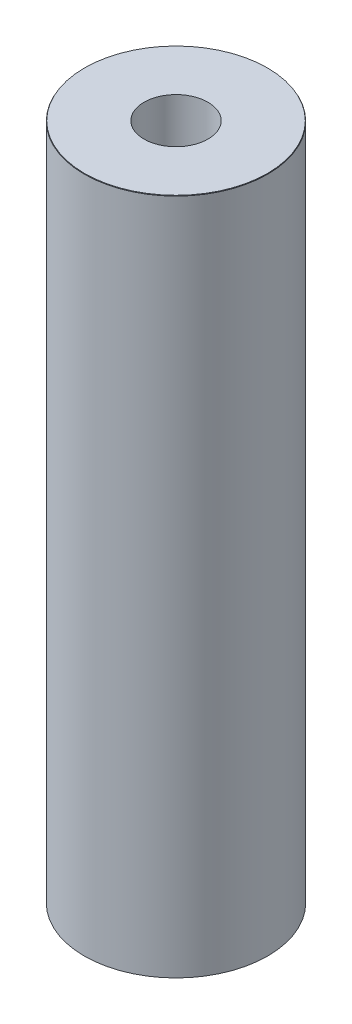
from build123d import *
from OCP.BRepFilletAPI import BRepFilletAPI_MakeChamfer

# Parameters (mm, degrees)
SKETCH1_R           = 47.5
BOSS_EXTRUDE1_DEPTH = 351.051559551
SKETCH2_R           = 16.556482022
CUT_EXTRUDE1_DEPTH  = 358.420896792
CHAMFER1_SIZE       = 0.263666676
CHAMFER1_SIZE2      = 0.148490883


with BuildPart() as part:
    # Sketch1 → Boss-Extrude1 (new body)
    with BuildSketch(Plane(origin=(0, 0, 0), x_dir=(1, 0, 0), z_dir=(0, 1, 0))):
        Circle(SKETCH1_R)
    extrude(amount=BOSS_EXTRUDE1_DEPTH)

    # Sketch2 → Cut-Extrude1 (cut, through all)
    with BuildSketch(Plane(origin=(0, 0, 0), x_dir=(1, 0, 0), z_dir=(0, 1, 0))):
        Circle(SKETCH2_R)
    extrude(amount=CUT_EXTRUDE1_DEPTH, mode=Mode.SUBTRACT)

    # Chamfer1: one chamfer whose edges measure the first distance from different faces: ONE call of the kernel's chamfer builder (chamfer() names one face for all edges)
    chamfer1_edges_1 = [part.edges().sort_by_distance(p)[0] for p in [
        (-47.5, 351.051559551, 0),
    ]]
    chamfer1_side_1 = [part.faces().sort_by_distance(p)[0] for p in [
        (-47.5, 175.525779776, 0),
    ]]
    chamfer1_edges_2 = [part.edges().sort_by_distance(p)[0] for p in [
        (-47.5, 0, 0),
    ]]
    chamfer1_side_2 = [part.faces().sort_by_distance(p)[0] for p in [
        (-46.156497116, 0, 0),
    ]]
    chamfer1 = BRepFilletAPI_MakeChamfer(part.part.solid().wrapped)
    for e in chamfer1_edges_1:
        chamfer1.Add(CHAMFER1_SIZE, CHAMFER1_SIZE2, e.wrapped, chamfer1_side_1[0].wrapped)  # the first distance lies on this face
    for e in chamfer1_edges_2:
        chamfer1.Add(CHAMFER1_SIZE, CHAMFER1_SIZE2, e.wrapped, chamfer1_side_2[0].wrapped)  # the first distance lies on this face
    add(Compound.cast(chamfer1.Shape()), mode=Mode.REPLACE)


solid = part.part
